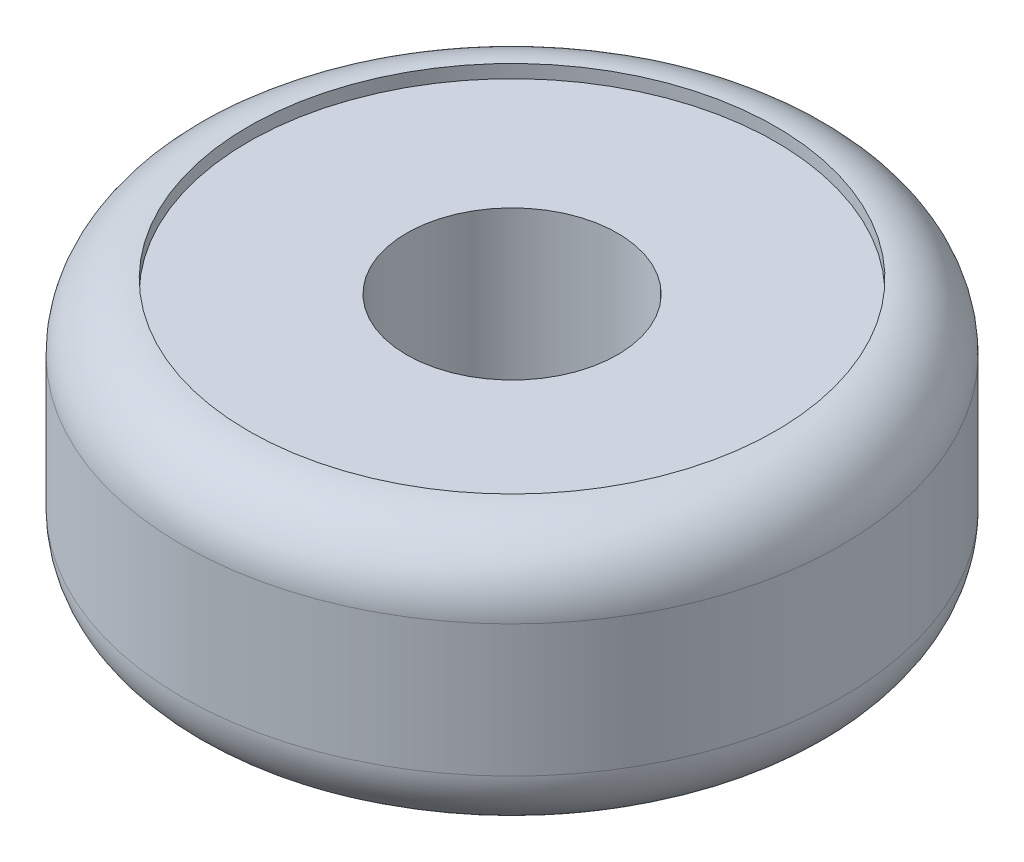
from build123d import *

# Parameters (mm, degrees)
SKETCH_1_R      = 4
SKETCH_1_R_2    = 1.6
EXTRUDE_1_DEPTH = 1.8
SKETCH_2_R      = 5
SKETCH_2_R_2    = 4
EXTRUDE_2_DEPTH = 2
FILLET_1_R      = 1


with BuildPart() as part:
    # 草图1 → 凸台-拉伸1 (new, symmetric)
    with BuildSketch(Plane(origin=(0, 0, 0), x_dir=(1, 0, 0), z_dir=(0, 1, 0))):
        with Locations(Location((0, 0, 0), (0, 0, 270))):
            Circle(SKETCH_1_R)
        with Locations(Location((0, 0, 0), (0, 0, 270))):
            Circle(SKETCH_1_R_2, mode=Mode.SUBTRACT)
    extrude(amount=EXTRUDE_1_DEPTH, both=True)

    # 草图2 → 凸台-拉伸2 (add, symmetric)
    with BuildSketch(Plane(origin=(0, 0, 0), x_dir=(1, 0, 0), z_dir=(0, 1, 0))):
        with Locations(Location((0, 0, 0), (0, 0, 270))):
            Circle(SKETCH_2_R)
        with Locations(Location((0, 0, 0), (0, 0, 270))):
            Circle(SKETCH_2_R_2, mode=Mode.SUBTRACT)
    extrude(amount=EXTRUDE_2_DEPTH, both=True)

    # 圆角1
    fillet_1_edges = [part.edges().sort_by_distance(p)[0] for p in [
        (0, -2, -5),
        (0, 2, -5),
    ]]
    fillet(fillet_1_edges, radius=FILLET_1_R - 0.0001)  # a hair under: the kernel refuses the full size


solid = part.part
